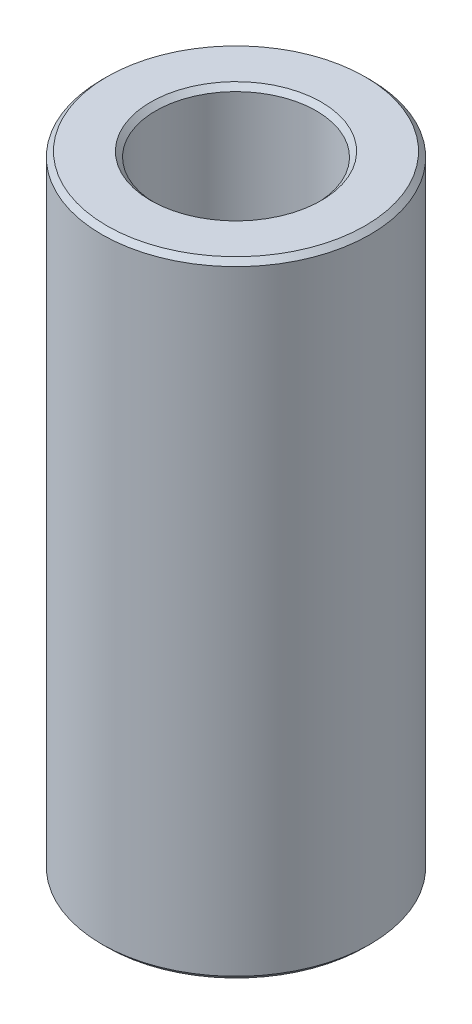
from build123d import *

# Parameters (mm, degrees)
SKETCH1_R           = 47.5
BOSS_EXTRUDE1_DEPTH = 221.203556067
SKETCH2_R           = 28.423117558
CUT_EXTRUDE1_DEPTH  = 232.178531046
CHAMFER1_SIZE       = 1.789083983


with BuildPart() as part:
    # Sketch1 → Boss-Extrude1 (new body)
    with BuildSketch(Plane(origin=(0, 0, 0), x_dir=(1, 0, 0), z_dir=(0, 1, 0))):
        Circle(SKETCH1_R)
    extrude(amount=BOSS_EXTRUDE1_DEPTH)

    # Sketch2 → Cut-Extrude1 (cut, through all)
    with BuildSketch(Plane(origin=(0, 0, 0), x_dir=(1, 0, 0), z_dir=(0, 1, 0))):
        Circle(SKETCH2_R)
    extrude(amount=CUT_EXTRUDE1_DEPTH, mode=Mode.SUBTRACT)

    # Chamfer1
    chamfer1_edges = [part.edges().sort_by_distance(p)[0] for p in [
        (-28.423117558, 221.203556067, 0),
        (-28.423117558, 0, 0),
        (-47.5, 0, 0),
        (-47.5, 221.203556067, 0),
    ]]
    chamfer(chamfer1_edges, length=CHAMFER1_SIZE)


solid = part.part
